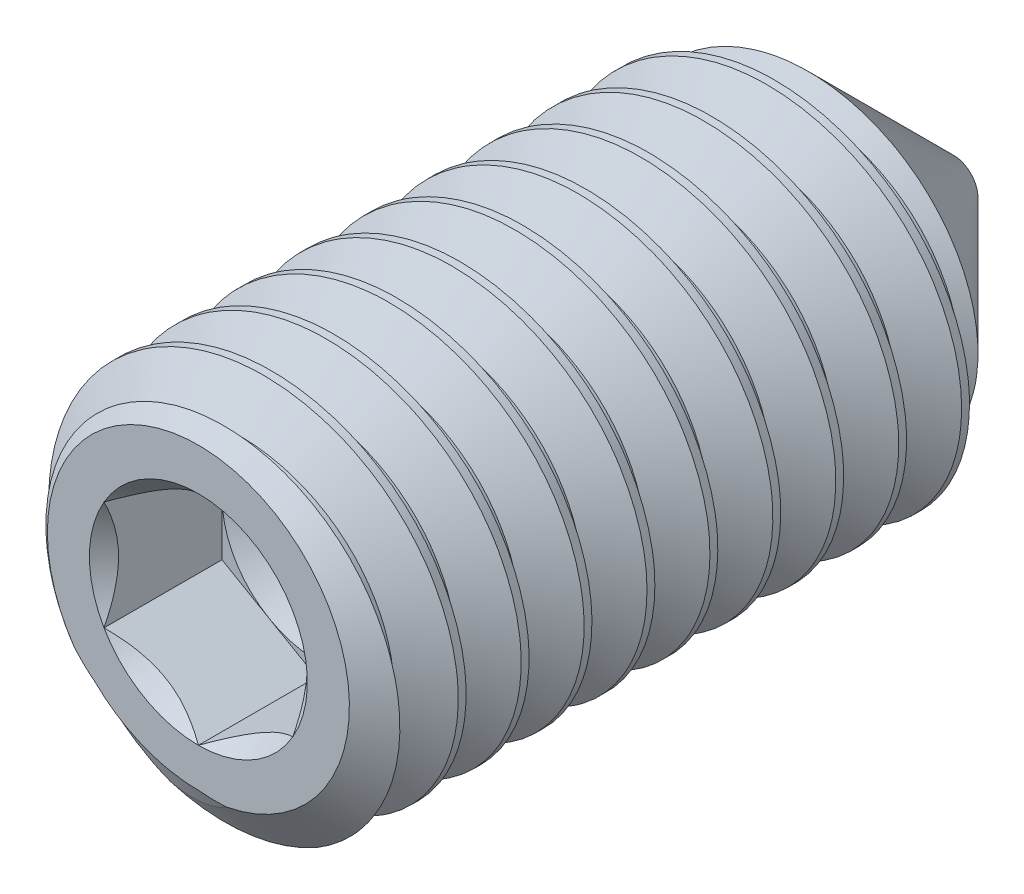
from build123d import *

# Parameters (mm, degrees)
HEX_EXTRUDE_DEPTH  = 0.9375
THREAD_SWEEP_PITCH = 0.5


with BuildPart() as part:
    # Body Sketch → Body Revolve (revolve)
    with BuildSketch(Plane(origin=(0, 0, 0), x_dir=(0, 0, -1), z_dir=(1, 0, 0)), mode=Mode.PRIVATE) as body_revolve_sk:
        Polygon((-3, 0), (-3, 1.2), (-2.789937739, 1.5), (1.695, 1.5), (3, 0.195), (3, 0), align=None)
    revolve(body_revolve_sk.sketch.rotate(Axis((0, 0, -3), (0, 0, 1)), 90), axis=Axis((0, 0, -3), (0, 0, 1)))

    # Hex Sketch → Hex Extrude (cut)
    with BuildSketch(Plane.XY.offset(3)):
        Polygon((0, 0.866025404), (-0.75, 0.433012702), (-0.75, -0.433012702), (0, -0.866025404), (0.75, -0.433012702), (0.75, 0.433012702), align=None)
    extrude(amount=-HEX_EXTRUDE_DEPTH, mode=Mode.SUBTRACT)

    # Hex Entry Extrude cone 1 section (through the dimple's axis) → Hex Entry Extrude (revolve, cut)
    with BuildSketch(Plane(origin=(0, 0, 3), x_dir=(0, -1, 0), z_dir=(1, 0, 0))):
        Polygon((0, 0), (0.866025404, 0), (0, 0.866025404), align=None)
    revolve(axis=Axis((0, 0, 3), (0, 0, -1)), mode=Mode.SUBTRACT)

    # Hex Bottom Extrude cone 1 section (through the dimple's axis) → Hex Bottom Extrude (revolve, cut)
    with BuildSketch(Plane(origin=(0, 0, 2.0625), x_dir=(0, -1, 0), z_dir=(1, 0, 0))):
        Polygon((0, 0), (0.75, 0), (0, 0.433012702), align=None)
    revolve(axis=Axis((0, 0, 2.0625), (0, 0, -1)), mode=Mode.SUBTRACT)

    # Thread Sweep: the profile of Sketch28 profile screwed along a right-hand helix of 13 turns, 6 arcs to a turn; built about Z, then put on its axis
    thread_sweep_z = Axis((0, 0, 0), (0, 0, 1))
    thread_sweep_corners = [(1.5003, 0, 0.000173205), (1.5003, 0, -0.437673205), (1.175240474, 0, -0.25), (1.175240474, 0, -0.1875)]
    with BuildLine(mode=Mode.PRIVATE) as thread_sweep_profile:
        Line(thread_sweep_corners[0], thread_sweep_corners[1])
        Line(thread_sweep_corners[1], thread_sweep_corners[2])
        Line(thread_sweep_corners[2], thread_sweep_corners[3])
        Line(thread_sweep_corners[3], thread_sweep_corners[0])
    thread_sweep_cap = Face(thread_sweep_profile.wire())
    thread_sweep_turn_angles = [0, 30, 60, 90, 120, 150, 180, 210, 240, 270, 300, 330, 360]
    thread_sweep_turn_weights = [1, 0.8660254037844387, 1, 0.8660254037844387, 1, 0.8660254037844387, 1, 0.8660254037844387, 1, 0.8660254037844387, 1, 0.8660254037844387, 1]
    thread_sweep_turn_rails = [Edge.make_bspline([Vector(p[0], p[1], 0).rotate(thread_sweep_z, thread_sweep_turn_angles[k]) / thread_sweep_turn_weights[k] + Vector(0, 0, p[2] + THREAD_SWEEP_PITCH * thread_sweep_turn_angles[k] / 360) for k in range(13)], [0, 0, 0, 1, 1, 2, 2, 3, 3, 4, 4, 5, 5, 6, 6, 6], 2, thread_sweep_turn_weights) for p in thread_sweep_corners]
    thread_sweep_turn_sides = [Face.make_surface_from_curves(thread_sweep_turn_rails[p[0]], thread_sweep_turn_rails[p[1]]) for p in [(0, 1), (1, 2), (2, 3), (3, 0)]]
    thread_sweep = Plane(origin=(0, 0, -3), x_dir=(0, 1, 0), z_dir=(0, 0, 1)) * Solid(Shell([*[p.moved(Location((0, 0, THREAD_SWEEP_PITCH * i))) for i in range(13) for p in thread_sweep_turn_sides], thread_sweep_cap, thread_sweep_cap.rotate(thread_sweep_z, 4680).moved(Location((0, 0, THREAD_SWEEP_PITCH * 4680 / 360)))]))
    add(thread_sweep, mode=Mode.SUBTRACT)


solid = part.part
